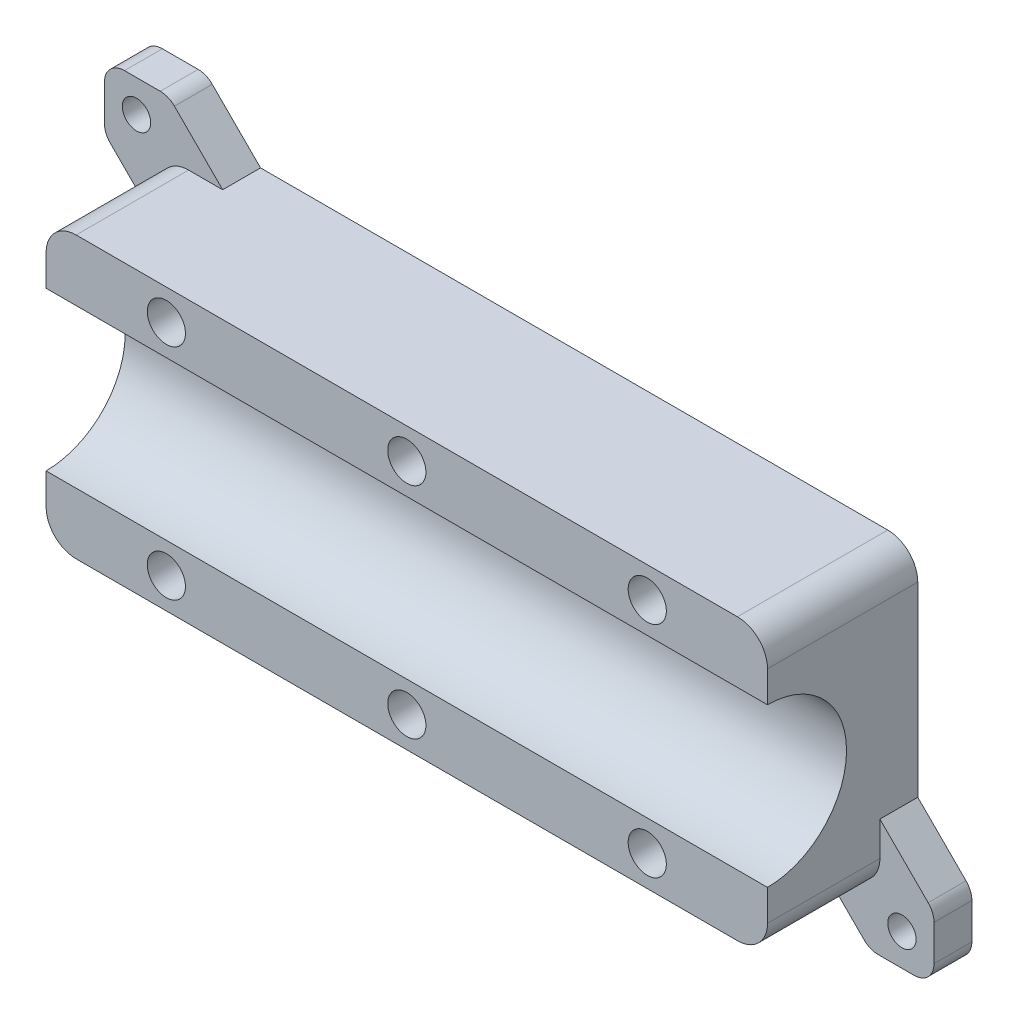
from build123d import *

# Parameters (mm, degrees)
SKETCH1_W               = 114.3
SKETCH1_H               = 44.45
BOSS_EXTRUDE1_DEPTH     = 5
BOSS_EXTRUDE2_DEPTH     = 114.3
SKETCH3_R               = 3.025
CUT_EXTRUDE1_DEPTH      = 8
LPATTERN1_COUNT         = 2
LPATTERN1_PITCH         = 38.1
LPATTERN1_COUNT_DIR2    = 2
LPATTERN1_PITCH_DIR2    = 38.1
MIRROR1_COPY_1_SKETCH_R = 3.025
MIRROR1_COPY_1_DEPTH    = 8
MIRROR1_COPY_2_SKETCH_R = 3.025
MIRROR1_COPY_2_DEPTH    = 8
MIRROR1_COPY_3_SKETCH_R = 3.025
MIRROR1_COPY_3_DEPTH    = 8
MIRROR1_COPY_4_SKETCH_R = 3.025
MIRROR1_COPY_4_DEPTH    = 8
BOSS_EXTRUDE3_DEPTH     = 6
M4_CLEARANCE_HOLE1_D    = 4.5
FILLET3_R               = 3.175
FILLET4_R               = 4.7625


with BuildPart() as part:
    # Sketch1 → Boss-Extrude1 (new body)
    with BuildSketch(Plane.XY):
        Rectangle(SKETCH1_W, SKETCH1_H)
    extrude(amount=BOSS_EXTRUDE1_DEPTH)

    # Sketch2 → Boss-Extrude2 (add)
    with BuildSketch(Plane.ZY.offset(57.15)):
        with BuildLine():
            Line((23.8125, 22.225), (5, 22.225))
            Line((5, 22.225), (5, -22.225))
            Line((5, -22.225), (23.8125, -22.225))
            Line((23.8125, -22.225), (23.8125, -12.5269))
            ThreePointArc((23.8125, -12.5269), (11.2856, 0), (23.8125, 12.5269))
            Line((23.8125, 12.5269), (23.8125, 22.225))
        make_face()
    extrude(amount=-BOSS_EXTRUDE2_DEPTH)

    # Sketch3 → Cut-Extrude1 (cut)
    with BuildSketch(Plane.XY.offset(23.8125)):
        with Locations((0, 17.37595)):
            Circle(SKETCH3_R)
    cut_extrude1 = extrude(amount=-CUT_EXTRUDE1_DEPTH, mode=Mode.SUBTRACT)

    # LPattern1: Cut-Extrude1 2 × 2
    with Locations(*[Vector(1, 0, 0) * (i * LPATTERN1_PITCH) + Vector(-1, 0, 0) * (j * LPATTERN1_PITCH_DIR2) for i in range(LPATTERN1_COUNT) for j in range(LPATTERN1_COUNT_DIR2) if (i, j) != (0, 0)]):
        add(cut_extrude1, mode=Mode.SUBTRACT)

    # Mirror1 copy 1 sketch → Mirror1 copy 1 (cut)
    with BuildSketch(Plane(origin=(-38.1, 0, 23.8125), x_dir=(1, 0, 0), z_dir=(0, 0, 1))):
        with Locations((0, -17.37595)):
            Circle(MIRROR1_COPY_1_SKETCH_R)
    extrude(amount=-MIRROR1_COPY_1_DEPTH, mode=Mode.SUBTRACT)

    # Mirror1 copy 2 sketch → Mirror1 copy 2 (cut)
    with BuildSketch(Plane(origin=(38.1, 0, 23.8125), x_dir=(1, 0, 0), z_dir=(0, 0, 1))):
        with Locations((0, -17.37595)):
            Circle(MIRROR1_COPY_2_SKETCH_R)
    extrude(amount=-MIRROR1_COPY_2_DEPTH, mode=Mode.SUBTRACT)

    # Mirror1 copy 3 sketch → Mirror1 copy 3 (cut)
    with BuildSketch(Plane.XY.offset(23.8125)):
        with Locations((0, -17.37595)):
            Circle(MIRROR1_COPY_3_SKETCH_R)
    extrude(amount=-MIRROR1_COPY_3_DEPTH, mode=Mode.SUBTRACT)

    # Mirror1 copy 4 sketch → Mirror1 copy 4 (cut)
    with BuildSketch(Plane.XY.offset(23.8125)):
        with Locations((0, -17.37595)):
            Circle(MIRROR1_COPY_4_SKETCH_R)
    extrude(amount=-MIRROR1_COPY_4_DEPTH, mode=Mode.SUBTRACT)

    # Sketch4 → Boss-Extrude3 (add)
    with BuildSketch(Plane.XY):
        Polygon((-57.15, 22.225), (-46.99, 22.225), (-55.5625, 30.7975), (-65.7225, 30.7975), (-65.7225, 20.6375), (-57.15, 12.065), align=None)
        Polygon((57.15, -22.225), (46.99, -22.225), (55.5625, -30.7975), (65.7225, -30.7975), (65.7225, -20.6375), (57.15, -12.065), align=None)
    extrude(amount=BOSS_EXTRUDE3_DEPTH)

    # M4 Clearance Hole1 (through all)
    with Locations(Plane.XY.offset(6)):
        with Locations((-60.6425, 25.7175), (60.6425, -25.7175)):
            Hole(M4_CLEARANCE_HOLE1_D / 2)

    # Fillet3
    fillet3_edges = [part.edges().sort_by_distance(p)[0] for p in [
        (-55.5625, 30.7975, 3),
        (-65.7225, 30.7975, 3),
        (-65.7225, 20.6375, 3),
        (65.7225, -20.6375, 3),
        (65.7225, -30.7975, 3),
        (55.5625, -30.7975, 3),
    ]]
    fillet(fillet3_edges, radius=FILLET3_R)

    # Fillet4
    fillet4_edges = [part.edges().sort_by_distance(p)[0] for p in [
        (57.15, 22.225, 11.90625),
        (-57.15, 22.225, 14.90625),
        (57.15, -22.225, 14.90625),
        (-57.15, -22.225, 11.90625),
    ]]
    fillet(fillet4_edges, radius=FILLET4_R)


solid = part.part
